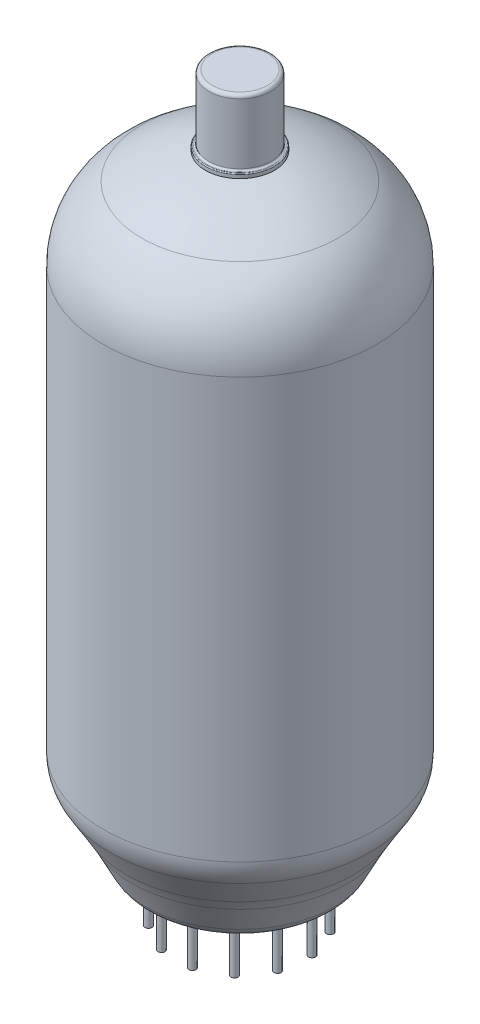
from build123d import *

# Parameters (mm, degrees)
CIRPATTERN1_COUNT           = 12
CIRPATTERN1_ANGLE           = 304.7
CUT_EXTRUDE1_DEPTH          = 2.54
CUT_EXTRUDE1_DEPTH_BACK     = 2.54
SKETCH7_R                   = 0.522536274
BOSS_EXTRUDE1_DEPTH         = 6.985
BOSS_EXTRUDE1_DEPTH_BACK    = 6.985
SKETCH7_2_R                 = 0.522536274
BOSS_EXTRUDE1_2_DEPTH       = 6.985
BOSS_EXTRUDE1_2_DEPTH_BACK  = 6.985
BOSS_EXTRUDE1_3_DEPTH       = 6.985
BOSS_EXTRUDE1_3_DEPTH_BACK  = 6.985
BOSS_EXTRUDE1_4_DEPTH       = 6.985
BOSS_EXTRUDE1_4_DEPTH_BACK  = 6.985
BOSS_EXTRUDE1_5_DEPTH       = 6.985
BOSS_EXTRUDE1_5_DEPTH_BACK  = 6.985
BOSS_EXTRUDE1_6_DEPTH       = 6.985
BOSS_EXTRUDE1_6_DEPTH_BACK  = 6.985
BOSS_EXTRUDE1_7_DEPTH       = 6.985
BOSS_EXTRUDE1_7_DEPTH_BACK  = 6.985
BOSS_EXTRUDE1_8_DEPTH       = 6.985
BOSS_EXTRUDE1_8_DEPTH_BACK  = 6.985
BOSS_EXTRUDE1_9_DEPTH       = 6.985
BOSS_EXTRUDE1_9_DEPTH_BACK  = 6.985
BOSS_EXTRUDE1_10_DEPTH      = 6.985
BOSS_EXTRUDE1_10_DEPTH_BACK = 6.985
BOSS_EXTRUDE1_11_DEPTH      = 6.985
BOSS_EXTRUDE1_11_DEPTH_BACK = 6.985
BOSS_EXTRUDE1_12_DEPTH      = 6.985
BOSS_EXTRUDE1_12_DEPTH_BACK = 6.985
FILLET2_R                   = 0.254
BOSS_EXTRUDE2_DEPTH         = 0.381
BOSS_EXTRUDE3_DEPTH         = 0.381
BOSS_EXTRUDE4_DEPTH         = 49.619
CUT_EXTRUDE2_DEPTH          = 32.512
CUT_EXTRUDE2_DEPTH_BACK     = 1.016
SKETCH11_W                  = 3.302
SKETCH11_H                  = 5.08
BOSS_EXTRUDE5_DEPTH         = 1.27
BOSS_EXTRUDE5_DEPTH_BACK    = 52.07
SKETCH14_R                  = 0.5953125
BOSS_EXTRUDE5_2_DEPTH       = 1.27
BOSS_EXTRUDE5_2_DEPTH_BACK  = 52.07
BOSS_EXTRUDE6_DEPTH         = 3.175
BOSS_EXTRUDE6_DEPTH_BACK    = 52.832
SKETCH15_R                  = 0.396875
BOSS_EXTRUDE6_2_DEPTH       = 3.175
BOSS_EXTRUDE6_2_DEPTH_BACK  = 52.832
SKETCH17_W                  = 0.2286
SKETCH17_H                  = 6.35
SKETCH18_W                  = 1.7145
SKETCH18_H                  = 3.175
BOSS_EXTRUDE7_DEPTH         = 0.508
BOSS_EXTRUDE7_2_DEPTH       = 0.508
SKETCH20_R                  = 0.3175
CUT_EXTRUDE3_DEPTH          = 3.175
CUT_EXTRUDE3_DEPTH_BACK     = 3.175
SKETCH21_W                  = 1.7145
SKETCH21_H                  = 3.175
SKETCH22_W                  = 4.8133
SKETCH22_H                  = 29.1338
SKETCH22_W_2                = 4.2545
SKETCH22_H_2                = 28.575
BOSS_EXTRUDE9_DEPTH         = 49
CUT_EXTRUDE5_DEPTH          = 0.254
CUT_EXTRUDE5_DEPTH_BACK     = 29.718
SKETCH23_W                  = 2.794
SKETCH23_H                  = 4.572
SKETCH24_R                  = 0.3175
BOSS_EXTRUDE10_DEPTH        = 12.446
BOSS_EXTRUDE10_2_DEPTH      = 12.446
BOSS_EXTRUDE11_DEPTH        = 1.905
BOSS_EXTRUDE11_DEPTH_BACK   = 41.148
SKETCH26_R                  = 0.127
SKETCH26_3_R                = 0.127


# Read off the part's stored shape, not the designer's step: Revolve-Thin2
with BuildPart() as part:
    # Sketch1 → Revolve-Thin1 (revolve)
    with BuildSketch(Plane.XY, mode=Mode.PRIVATE) as revolve_thin1_sk:
        with BuildLine():
            ThreePointArc((0, 91.2876), (7.482080905, 90.160598688), (14.3002, 86.879605144))
            ThreePointArc((14.3002, 86.879605144), (18.377216059, 82.320088485), (19.8501, 76.383602572))
            Line((19.8501, 76.383602572), (19.8501, 14.642450749))
            ThreePointArc((19.8501, 14.642450749), (19.619689794, 12.947422504), (18.945180078, 11.375402702))
            Line((18.945180078, 11.375402702), (16.505696372, 7.309596526))
            ThreePointArc((16.505696372, 7.309596526), (16.053521816, 6.526156501), (15.628175452, 5.727832899))
            Line((15.628175452, 5.727832899), (13.584296531, 1.72978117))
            ThreePointArc((13.584296531, 1.72978117), (12.414403956, 0.466753816), (10.757289715, 0))
            Line((10.757289715, 0), (3.060575478, 0))
            ThreePointArc((3.060575478, 0), (2.657992523, -0.14392774), (2.437906749, -0.510466254))
            Line((2.437906749, -0.510466254), (1.372093251, -5.839533746))
            ThreePointArc((1.372093251, -5.839533746), (1.152007477, -6.20607226), (0.749424522, -6.35))
            Line((0.749424522, -6.35), (0, -6.35))
            Line((0, -6.35), (0, -6.604))
            Line((0, -6.604), (0.749424522, -6.604))
            ThreePointArc((0.749424522, -6.604), (1.313040659, -6.402501164), (1.621160742, -5.889347244))
            Line((1.621160742, -5.889347244), (2.686974241, -0.560279753))
            ThreePointArc((2.686974241, -0.560279753), (2.819025705, -0.340356644), (3.060575478, -0.254))
            Line((3.060575478, -0.254), (10.757289715, -0.254))
            ThreePointArc((10.757289715, -0.254), (12.546973095, 0.250094121), (13.810457076, 1.614163664))
            Line((13.810457076, 1.614163664), (15.854335998, 5.612215393))
            ThreePointArc((15.854335998, 5.612215393), (16.275631444, 6.402935912), (16.723499575, 7.178914604))
            Line((16.723499575, 7.178914604), (19.162983281, 11.244720781))
            ThreePointArc((19.162983281, 11.244720781), (19.864473386, 12.879621375), (20.1041, 14.642450749))
            Line((20.1041, 14.642450749), (20.1041, 76.383602572))
            ThreePointArc((20.1041, 76.383602572), (18.60175838, 82.438818204), (14.443202, 87.089525195))
            ThreePointArc((14.443202, 87.089525195), (7.556901714, 90.403328675), (0, 91.5416))
            Line((0, 91.5416), (0, 91.2876))
        make_face()
    revolve(revolve_thin1_sk.sketch.rotate(Axis((0, 0, 0), (0, 1, 0)), 90), axis=Axis((0, 0, 0), (0, 1, 0)))

    # Sketch6 → Revolve1 (revolve)
    with BuildSketch(Plane(origin=(4.420259293, -0.254, -8.437234901), x_dir=(-0.8857989397800274, 0, -0.4640692171266903), z_dir=(0.4640692171266903, 0, -0.8857989397800274)), mode=Mode.PRIVATE) as revolve1_sk:
        Polygon((0, 0), (0, -0.635), (-0.508, -0.635), (-1.143, 0), align=None)
    revolve1 = revolve(revolve1_sk.sketch.rotate(Axis((4.420259293, -0.254, -8.437234901), (0, -1, 0)), 62.35), axis=Axis((4.420259293, -0.254, -8.437234901), (0, -1, 0)))

    # CirPattern1: Revolve1 ×12 about axis
    cirpattern1_axis = Axis((0, 0, 0), (0, -1, 0))
    for i in range(1, CIRPATTERN1_COUNT):
        add(revolve1.rotate(cirpattern1_axis, i * CIRPATTERN1_ANGLE / (CIRPATTERN1_COUNT - 1)))

    # Sketch7 → Cut-Extrude1 (cut, two sides: drawn at the far end of the back side and taken through both)
    with BuildSketch(Plane.XZ.offset(0.254).offset(-CUT_EXTRUDE1_DEPTH_BACK)):
        with Locations(Location((4.420259293, -8.437234901, 0), (0, 0, 90))):
            Circle(SKETCH7_R)
        with Locations(Location((7.835650934, -5.415551628, 0), (0, 0, 90))):
            Circle(SKETCH7_R)
        with Locations(Location((9.455011488, -1.152554882, 0), (0, 0, 90))):
            Circle(SKETCH7_R)
        with Locations(Location((8.907162872, 3.374622137, 0), (0, 0, 90))):
            Circle(SKETCH7_R)
        with Locations(Location((6.317678973, 7.128292741, 0), (0, 0, 270))):
            Circle(SKETCH7_R)
        with Locations(Location((2.280102512, 9.248067773, 0), (0, 0, 270))):
            Circle(SKETCH7_R)
        with Locations(Location((-2.280102512, 9.248067773, 0), (0, 0, 270))):
            Circle(SKETCH7_R)
        with Locations(Location((-6.317678973, 7.128292741, 0), (0, 0, 270))):
            Circle(SKETCH7_R)
        with Locations(Location((-8.907162872, 3.374622137, 0), (0, 0, 270))):
            Circle(SKETCH7_R)
        with Locations(Location((-9.455011488, -1.152554882, 0), (0, 0, 270))):
            Circle(SKETCH7_R)
        with Locations(Location((-7.835650934, -5.415551628, 0), (0, 0, 90))):
            Circle(SKETCH7_R)
        with Locations(Location((-4.420259293, -8.437234901, 0), (0, 0, 90))):
            Circle(SKETCH7_R)
    extrude(amount=CUT_EXTRUDE1_DEPTH + CUT_EXTRUDE1_DEPTH_BACK, mode=Mode.SUBTRACT)



with BuildPart() as body_2:
    # Revolve-Thin2 outline → Revolve-Thin2 (revolve)
    with BuildSketch(Plane.XY):
        with BuildLine():
            Line((4.826, 91.4146), (4.826, 91.0336))
            Line((4.826, 91.0336), (5.08, 91.0336))
            Line((5.08, 91.0336), (5.08, 91.5416))
            ThreePointArc((5.08, 91.5416), (5.042802561, 91.631402561), (4.953, 91.6686))
            Line((4.953, 91.6686), (4.826, 91.6686))
            ThreePointArc((4.826, 91.6686), (4.646394878, 91.742994878), (4.572, 91.9226))
            Line((4.572, 91.9226), (4.572, 100.838))
            ThreePointArc((4.572, 100.838), (4.423210245, 101.197210245), (4.064, 101.346))
            Line((4.064, 101.346), (0, 101.346))
            Line((0, 101.346), (0, 101.092))
            Line((0, 101.092), (4.064, 101.092))
            ThreePointArc((4.064, 101.092), (4.243605122, 101.017605122), (4.318, 100.838))
            Line((4.318, 100.838), (4.318, 91.9226))
            ThreePointArc((4.318, 91.9226), (4.466789755, 91.563389755), (4.826, 91.4146))
        make_face()
    revolve(axis=Axis((0, 0, 0), (0, 1, 0)))


with BuildPart() as body_3:
    # Sketch7<2> → Boss-Extrude1 (new, two sides: drawn at the far end of the back side and taken through both)
    with BuildSketch(Plane.XZ.offset(0.254).offset(-BOSS_EXTRUDE1_DEPTH_BACK)):
        with Locations(Location((4.420259293, -8.437234901, 0), (0, 0, 270))):
            Circle(SKETCH7_2_R)
    extrude(amount=BOSS_EXTRUDE1_DEPTH + BOSS_EXTRUDE1_DEPTH_BACK)

    # Fillet2
    fillet2_edges = [body_3.edges().sort_by_distance(p)[0] for p in [
        (4.420259293, -7.239, -7.914698628),
    ]]
    fillet(fillet2_edges, radius=FILLET2_R)


with BuildPart() as body_4:
    # Sketch7<2> → Boss-Extrude1 2 (new, two sides: drawn at the far end of the back side and taken through both)
    with BuildSketch(Plane.XZ.offset(0.254).offset(-BOSS_EXTRUDE1_2_DEPTH_BACK)):
        with Locations(Location((7.835650934, -5.415551628, 0), (0, 0, 270))):
            Circle(SKETCH7_2_R)
    extrude(amount=BOSS_EXTRUDE1_2_DEPTH + BOSS_EXTRUDE1_2_DEPTH_BACK)


with BuildPart() as body_5:
    # Sketch7<2> → Boss-Extrude1 3 (new, two sides: drawn at the far end of the back side and taken through both)
    with BuildSketch(Plane.XZ.offset(0.254).offset(-BOSS_EXTRUDE1_3_DEPTH_BACK)):
        with Locations(Location((9.455011488, -1.152554882, 0), (0, 0, 270))):
            Circle(SKETCH7_2_R)
    extrude(amount=BOSS_EXTRUDE1_3_DEPTH + BOSS_EXTRUDE1_3_DEPTH_BACK)


with BuildPart() as body_6:
    # Sketch7<2> → Boss-Extrude1 4 (new, two sides: drawn at the far end of the back side and taken through both)
    with BuildSketch(Plane.XZ.offset(0.254).offset(-BOSS_EXTRUDE1_4_DEPTH_BACK)):
        with Locations(Location((8.907162872, 3.374622137, 0), (0, 0, 270))):
            Circle(SKETCH7_2_R)
    extrude(amount=BOSS_EXTRUDE1_4_DEPTH + BOSS_EXTRUDE1_4_DEPTH_BACK)


with BuildPart() as body_7:
    # Sketch7<2> → Boss-Extrude1 5 (new, two sides: drawn at the far end of the back side and taken through both)
    with BuildSketch(Plane.XZ.offset(0.254).offset(-BOSS_EXTRUDE1_5_DEPTH_BACK)):
        with Locations(Location((6.317678973, 7.128292741, 0), (0, 0, 270))):
            Circle(SKETCH7_2_R)
    extrude(amount=BOSS_EXTRUDE1_5_DEPTH + BOSS_EXTRUDE1_5_DEPTH_BACK)


with BuildPart() as body_8:
    # Sketch7<2> → Boss-Extrude1 6 (new, two sides: drawn at the far end of the back side and taken through both)
    with BuildSketch(Plane.XZ.offset(0.254).offset(-BOSS_EXTRUDE1_6_DEPTH_BACK)):
        with Locations(Location((2.280102512, 9.248067773, 0), (0, 0, 270))):
            Circle(SKETCH7_2_R)
    extrude(amount=BOSS_EXTRUDE1_6_DEPTH + BOSS_EXTRUDE1_6_DEPTH_BACK)


with BuildPart() as body_9:
    # Sketch7<2> → Boss-Extrude1 7 (new, two sides: drawn at the far end of the back side and taken through both)
    with BuildSketch(Plane.XZ.offset(0.254).offset(-BOSS_EXTRUDE1_7_DEPTH_BACK)):
        with Locations(Location((-2.280102512, 9.248067773, 0), (0, 0, 270))):
            Circle(SKETCH7_2_R)
    extrude(amount=BOSS_EXTRUDE1_7_DEPTH + BOSS_EXTRUDE1_7_DEPTH_BACK)


with BuildPart() as body_10:
    # Sketch7<2> → Boss-Extrude1 8 (new, two sides: drawn at the far end of the back side and taken through both)
    with BuildSketch(Plane.XZ.offset(0.254).offset(-BOSS_EXTRUDE1_8_DEPTH_BACK)):
        with Locations(Location((-6.317678973, 7.128292741, 0), (0, 0, 270))):
            Circle(SKETCH7_2_R)
    extrude(amount=BOSS_EXTRUDE1_8_DEPTH + BOSS_EXTRUDE1_8_DEPTH_BACK)


with BuildPart() as body_11:
    # Sketch7<2> → Boss-Extrude1 9 (new, two sides: drawn at the far end of the back side and taken through both)
    with BuildSketch(Plane.XZ.offset(0.254).offset(-BOSS_EXTRUDE1_9_DEPTH_BACK)):
        with Locations(Location((-8.907162872, 3.374622137, 0), (0, 0, 270))):
            Circle(SKETCH7_2_R)
    extrude(amount=BOSS_EXTRUDE1_9_DEPTH + BOSS_EXTRUDE1_9_DEPTH_BACK)


with BuildPart() as body_12:
    # Sketch7<2> → Boss-Extrude1 10 (new, two sides: drawn at the far end of the back side and taken through both)
    with BuildSketch(Plane.XZ.offset(0.254).offset(-BOSS_EXTRUDE1_10_DEPTH_BACK)):
        with Locations(Location((-9.455011488, -1.152554882, 0), (0, 0, 270))):
            Circle(SKETCH7_2_R)
    extrude(amount=BOSS_EXTRUDE1_10_DEPTH + BOSS_EXTRUDE1_10_DEPTH_BACK)


with BuildPart() as body_13:
    # Sketch7<2> → Boss-Extrude1 11 (new, two sides: drawn at the far end of the back side and taken through both)
    with BuildSketch(Plane.XZ.offset(0.254).offset(-BOSS_EXTRUDE1_11_DEPTH_BACK)):
        with Locations(Location((-7.835650934, -5.415551628, 0), (0, 0, 270))):
            Circle(SKETCH7_2_R)
    extrude(amount=BOSS_EXTRUDE1_11_DEPTH + BOSS_EXTRUDE1_11_DEPTH_BACK)


with BuildPart() as body_14:
    # Sketch7<2> → Boss-Extrude1 12 (new, two sides: drawn at the far end of the back side and taken through both)
    with BuildSketch(Plane.XZ.offset(0.254).offset(-BOSS_EXTRUDE1_12_DEPTH_BACK)):
        with Locations(Location((-4.420259293, -8.437234901, 0), (0, 0, 270))):
            Circle(SKETCH7_2_R)
    extrude(amount=BOSS_EXTRUDE1_12_DEPTH + BOSS_EXTRUDE1_12_DEPTH_BACK)


with BuildPart() as body_15:
    # Sketch8 → Boss-Extrude2 (new body)
    with BuildSketch(Plane(origin=(0, 19.05, 0), x_dir=(1, 0, 0), z_dir=(0, 1, 0))):
        with BuildLine():
            Line((-9.438620861, 17.4625), (9.438620861, 17.4625))
            Line((9.438620861, 17.4625), (8.720765979, 16.219138872))
            ThreePointArc((8.720765979, 16.219138872), (9.982707907, 15.474423021), (11.181444024, 14.631730401))
            Line((11.181444024, 14.631730401), (12.759398331, 15.2060588))
            Line((12.759398331, 15.2060588), (12.467804161, 13.552346085))
            ThreePointArc((12.467804161, 13.552346085), (13.845130055, 12.141853185), (15.063778888, 10.592204238))
            Line((15.063778888, 10.592204238), (16.741404539, 10.665450956))
            Line((16.741404539, 10.665450956), (15.966025232, 9.175961165))
            ThreePointArc((15.966025232, 9.175961165), (16.855460888, 7.416580294), (17.551718512, 5.572199053))
            Line((17.551718512, 5.572199053), (19.173724244, 5.137583927))
            Line((19.173724244, 5.137583927), (17.986333638, 3.950193321))
            ThreePointArc((17.986333638, 3.950193321), (18.415, 0), (17.986333638, -3.950193321))
            Line((17.986333638, -3.950193321), (19.173724244, -5.137583927))
            Line((19.173724244, -5.137583927), (17.551718512, -5.572199053))
            ThreePointArc((17.551718512, -5.572199053), (16.855460888, -7.416580294), (15.966025232, -9.175961165))
            Line((15.966025232, -9.175961165), (16.741404539, -10.665450956))
            Line((16.741404539, -10.665450956), (15.063778888, -10.592204238))
            ThreePointArc((15.063778888, -10.592204238), (13.845130055, -12.141853185), (12.467804161, -13.552346085))
            Line((12.467804161, -13.552346085), (12.759398331, -15.2060588))
            Line((12.759398331, -15.2060588), (11.181444024, -14.631730401))
            ThreePointArc((11.181444024, -14.631730401), (9.982707907, -15.474423021), (8.720765979, -16.219138872))
            Line((8.720765979, -16.219138872), (9.438620861, -17.4625))
            Line((9.438620861, -17.4625), (-9.438620861, -17.4625))
            Line((-9.438620861, -17.4625), (-8.720765979, -16.219138872))
            ThreePointArc((-8.720765979, -16.219138872), (-9.982707907, -15.474423021), (-11.181444024, -14.631730401))
            Line((-11.181444024, -14.631730401), (-12.759398331, -15.2060588))
            Line((-12.759398331, -15.2060588), (-12.467804161, -13.552346085))
            ThreePointArc((-12.467804161, -13.552346085), (-13.845130055, -12.141853185), (-15.063778888, -10.592204238))
            Line((-15.063778888, -10.592204238), (-16.741404539, -10.665450956))
            Line((-16.741404539, -10.665450956), (-15.966025232, -9.175961165))
            ThreePointArc((-15.966025232, -9.175961165), (-16.855460888, -7.416580294), (-17.551718512, -5.572199053))
            Line((-17.551718512, -5.572199053), (-19.173724244, -5.137583927))
            Line((-19.173724244, -5.137583927), (-17.986333638, -3.950193321))
            ThreePointArc((-17.986333638, -3.950193321), (-18.415, 0), (-17.986333638, 3.950193321))
            Line((-17.986333638, 3.950193321), (-19.173724244, 5.137583927))
            Line((-19.173724244, 5.137583927), (-17.551718512, 5.572199053))
            ThreePointArc((-17.551718512, 5.572199053), (-16.855460888, 7.416580294), (-15.966025232, 9.175961165))
            Line((-15.966025232, 9.175961165), (-16.741404539, 10.665450956))
            Line((-16.741404539, 10.665450956), (-15.063778888, 10.592204238))
            ThreePointArc((-15.063778888, 10.592204238), (-13.845130055, 12.141853185), (-12.467804161, 13.552346085))
            Line((-12.467804161, 13.552346085), (-12.759398331, 15.2060588))
            Line((-12.759398331, 15.2060588), (-11.181444024, 14.631730401))
            ThreePointArc((-11.181444024, 14.631730401), (-9.982707907, 15.474423021), (-8.720765979, 16.219138872))
            Line((-8.720765979, 16.219138872), (-9.438620861, 17.4625))
        make_face()
    extrude(amount=BOSS_EXTRUDE2_DEPTH)


with BuildPart() as body_16:
    # Sketch9 → Boss-Extrude3 (new body)
    with BuildSketch(Plane(origin=(0, 69.05, 0), x_dir=(1, 0, 0), z_dir=(0, 1, 0))):
        with BuildLine():
            Line((-9.438620861, 17.4625), (9.438620861, 17.4625))
            Line((9.438620861, 17.4625), (8.720765979, 16.219138872))
            ThreePointArc((8.720765979, 16.219138872), (9.982707907, 15.474423021), (11.181444024, 14.631730401))
            Line((11.181444024, 14.631730401), (12.759398331, 15.2060588))
            Line((12.759398331, 15.2060588), (12.467804161, 13.552346085))
            ThreePointArc((12.467804161, 13.552346085), (13.845130055, 12.141853185), (15.063778888, 10.592204238))
            Line((15.063778888, 10.592204238), (16.741404539, 10.665450956))
            Line((16.741404539, 10.665450956), (15.966025232, 9.175961165))
            ThreePointArc((15.966025232, 9.175961165), (16.855460888, 7.416580294), (17.551718512, 5.572199053))
            Line((17.551718512, 5.572199053), (19.173724244, 5.137583927))
            Line((19.173724244, 5.137583927), (17.986333638, 3.950193321))
            ThreePointArc((17.986333638, 3.950193321), (18.415, 0), (17.986333638, -3.950193321))
            Line((17.986333638, -3.950193321), (19.173724244, -5.137583927))
            Line((19.173724244, -5.137583927), (17.551718512, -5.572199053))
            ThreePointArc((17.551718512, -5.572199053), (16.855460888, -7.416580294), (15.966025232, -9.175961165))
            Line((15.966025232, -9.175961165), (16.741404539, -10.665450956))
            Line((16.741404539, -10.665450956), (15.063778888, -10.592204238))
            ThreePointArc((15.063778888, -10.592204238), (13.845130055, -12.141853185), (12.467804161, -13.552346085))
            Line((12.467804161, -13.552346085), (12.759398331, -15.2060588))
            Line((12.759398331, -15.2060588), (11.181444024, -14.631730401))
            ThreePointArc((11.181444024, -14.631730401), (9.982707907, -15.474423021), (8.720765979, -16.219138872))
            Line((8.720765979, -16.219138872), (9.438620861, -17.4625))
            Line((9.438620861, -17.4625), (-9.438620861, -17.4625))
            Line((-9.438620861, -17.4625), (-8.720765979, -16.219138872))
            ThreePointArc((-8.720765979, -16.219138872), (-9.982707907, -15.474423021), (-11.181444024, -14.631730401))
            Line((-11.181444024, -14.631730401), (-12.759398331, -15.2060588))
            Line((-12.759398331, -15.2060588), (-12.467804161, -13.552346085))
            ThreePointArc((-12.467804161, -13.552346085), (-13.845130055, -12.141853185), (-15.063778888, -10.592204238))
            Line((-15.063778888, -10.592204238), (-16.741404539, -10.665450956))
            Line((-16.741404539, -10.665450956), (-15.966025232, -9.175961165))
            ThreePointArc((-15.966025232, -9.175961165), (-16.855460888, -7.416580294), (-17.551718512, -5.572199053))
            Line((-17.551718512, -5.572199053), (-19.173724244, -5.137583927))
            Line((-19.173724244, -5.137583927), (-17.986333638, -3.950193321))
            ThreePointArc((-17.986333638, -3.950193321), (-18.415, 0), (-17.986333638, 3.950193321))
            Line((-17.986333638, 3.950193321), (-19.173724244, 5.137583927))
            Line((-19.173724244, 5.137583927), (-17.551718512, 5.572199053))
            ThreePointArc((-17.551718512, 5.572199053), (-16.855460888, 7.416580294), (-15.966025232, 9.175961165))
            Line((-15.966025232, 9.175961165), (-16.741404539, 10.665450956))
            Line((-16.741404539, 10.665450956), (-15.063778888, 10.592204238))
            ThreePointArc((-15.063778888, 10.592204238), (-13.845130055, 12.141853185), (-12.467804161, 13.552346085))
            Line((-12.467804161, 13.552346085), (-12.759398331, 15.2060588))
            Line((-12.759398331, 15.2060588), (-11.181444024, 14.631730401))
            ThreePointArc((-11.181444024, 14.631730401), (-9.982707907, 15.474423021), (-8.720765979, 16.219138872))
            Line((-8.720765979, 16.219138872), (-9.438620861, 17.4625))
        make_face()
    extrude(amount=BOSS_EXTRUDE3_DEPTH)


with BuildPart() as body_17:
    # Sketch10 → Boss-Extrude4 (new body)
    with BuildSketch(Plane(origin=(0, 19.431, 0), x_dir=(1, 0, 0), z_dir=(0, 1, 0))):
        Polygon((-3.175, 4.7625), (-3.175, 14.605), (-1.905, 15.875), (1.905, 15.875), (3.175, 14.605), (3.175, 4.7625), (6.35, 4.7625), (6.985, 4.1275), (6.985, 0.254), (14.9225, 0.254), (14.9225, -0.254), (6.985, -0.254), (6.985, -4.1275), (6.35, -4.7625), (3.175, -4.7625), (3.175, -14.605), (1.905, -15.875), (-1.905, -15.875), (-3.175, -14.605), (-3.175, -4.7625), (-6.35, -4.7625), (-6.985, -4.1275), (-6.985, -0.254), (-14.9225, -0.254), (-14.9225, 0.254), (-6.985, 0.254), (-6.985, 4.1275), (-6.35, 4.7625), align=None)
        Polygon((-2.9464, 4.5339), (-2.9464, 14.51031078), (-1.81031078, 15.6464), (1.81031078, 15.6464), (2.9464, 14.51031078), (2.9464, 4.5339), (6.25531078, 4.5339), (6.7564, 4.03281078), (6.7564, -4.03281078), (6.25531078, -4.5339), (2.9464, -4.5339), (2.9464, -14.51031078), (1.81031078, -15.6464), (-1.81031078, -15.6464), (-2.9464, -14.51031078), (-2.9464, -4.5339), (-6.25531078, -4.5339), (-6.7564, -4.03281078), (-6.7564, 4.03281078), (-6.25531078, 4.5339), align=None, mode=Mode.SUBTRACT)
    extrude(amount=BOSS_EXTRUDE4_DEPTH)

    # Sketch11 → Cut-Extrude2 (cut, two sides: drawn at the far end of the back side and taken through both)
    with BuildSketch(Plane.XY.offset(-15.6464).offset(-CUT_EXTRUDE2_DEPTH_BACK)):
        with Locations((0, 29.0005)):
            Rectangle(SKETCH11_W, SKETCH11_H)
        with Locations((0, 49.3205)):
            Rectangle(SKETCH11_W, SKETCH11_H)
        with Locations((0, 59.4805)):
            Rectangle(SKETCH11_W, SKETCH11_H)
        with Locations((0, 39.1605)):
            Rectangle(SKETCH11_W, SKETCH11_H)
    extrude(amount=CUT_EXTRUDE2_DEPTH + CUT_EXTRUDE2_DEPTH_BACK, mode=Mode.SUBTRACT)

    # Sketch21 → Cut-Extrude3 (cut, two sides: drawn at the far end of the back side and taken through both)
    with BuildSketch(Plane.XY.offset(0.254).offset(-CUT_EXTRUDE3_DEPTH_BACK)):
        with Locations((-12.35075, 62.3825)):
            Rectangle(SKETCH21_W, SKETCH21_H)
        with Locations((-12.35075, 28.6385)):
            Rectangle(SKETCH21_W, SKETCH21_H)
        with Locations((12.35075, 28.6385)):
            Rectangle(SKETCH21_W, SKETCH21_H)
        with Locations((12.35075, 62.3825)):
            Rectangle(SKETCH21_W, SKETCH21_H)
    extrude(amount=CUT_EXTRUDE3_DEPTH + CUT_EXTRUDE3_DEPTH_BACK, mode=Mode.SUBTRACT)


with BuildPart() as body_18:
    # Sweep1: sweep along a path in Sketch12
    with BuildLine(Plane(origin=(0, 69.431, 0), x_dir=(1, 0, 0), z_dir=(0, 1, 0))) as sweep1_path:
        Line((-1.905, -9.525), (1.905, -9.525))
        ThreePointArc((1.905, -9.525), (2.803025612, -9.153025612), (3.175, -8.255))
        Line((3.175, -8.255), (3.175, 8.255))
        ThreePointArc((3.175, 8.255), (2.803025612, 9.153025612), (1.905, 9.525))
        Line((1.905, 9.525), (-1.905, 9.525))
        ThreePointArc((-1.905, 9.525), (-2.803025612, 9.153025612), (-3.175, 8.255))
        Line((-3.175, 8.255), (-3.175, -8.255))
        ThreePointArc((-3.175, -8.255), (-2.803025612, -9.153025612), (-1.905, -9.525))
    # Sketch13 → Sweep1 (sweep)
    with BuildSketch(Plane(origin=(-3.175, 69.431, 8.255), x_dir=(-1, 0, 0), z_dir=(0, 0, -1))):
        with BuildLine():
            Line((0, 0), (-0.450022883, 0.27001373))
            ThreePointArc((-0.450022883, 0.27001373), (-0.585546164, 0.409000286), (-0.635, 0.596718534))
            Line((-0.635, 0.596718534), (-0.635, 0.762))
            Line((-0.635, 0.762), (-0.5715, 0.762))
            Line((-0.5715, 0.762), (-0.5715, 0.596718534))
            ThreePointArc((-0.5715, 0.596718534), (-0.53028847, 0.440286661), (-0.417352402, 0.32446453))
            Line((-0.417352402, 0.32446453), (0.03267048, 0.054450801))
            Line((0.03267048, 0.054450801), (0.635, 0.054450801))
            Line((0.635, 0.054450801), (0.635, 0))
            Line((0.635, 0), (0, 0))
        make_face()
    sweep(path=sweep1_path.line)


with BuildPart() as body_19:
    # Sketch14 → Boss-Extrude5 (new, two sides: drawn at the far end of the back side and taken through both)
    with BuildSketch(Plane(origin=(0, 69.431, 0), x_dir=(1, 0, 0), z_dir=(0, 1, 0)).offset(-BOSS_EXTRUDE5_DEPTH_BACK)):
        with Locations(Location((0, 6.35, 0), (0, 0, 270))):
            Circle(SKETCH14_R)
    extrude(amount=BOSS_EXTRUDE5_DEPTH + BOSS_EXTRUDE5_DEPTH_BACK)


with BuildPart() as body_20:
    # Sketch14 → Boss-Extrude5 2 (new, two sides: drawn at the far end of the back side and taken through both)
    with BuildSketch(Plane(origin=(0, 69.431, 0), x_dir=(1, 0, 0), z_dir=(0, 1, 0)).offset(-BOSS_EXTRUDE5_2_DEPTH_BACK)):
        with Locations(Location((0, -6.35, 0), (0, 0, 270))):
            Circle(SKETCH14_R)
    extrude(amount=BOSS_EXTRUDE5_2_DEPTH + BOSS_EXTRUDE5_2_DEPTH_BACK)


with BuildPart() as body_21:
    # Sketch15 → Boss-Extrude6 (new, two sides: drawn at the far end of the back side and taken through both)
    with BuildSketch(Plane(origin=(0, 69.431, 0), x_dir=(1, 0, 0), z_dir=(0, 1, 0)).offset(-BOSS_EXTRUDE6_DEPTH_BACK)):
        with Locations(Location((0, 2.8575, 0), (0, 0, 270))):
            Circle(SKETCH15_R)
    extrude(amount=BOSS_EXTRUDE6_DEPTH + BOSS_EXTRUDE6_DEPTH_BACK)


with BuildPart() as body_22:
    # Sketch15 → Boss-Extrude6 2 (new, two sides: drawn at the far end of the back side and taken through both)
    with BuildSketch(Plane(origin=(0, 69.431, 0), x_dir=(1, 0, 0), z_dir=(0, 1, 0)).offset(-BOSS_EXTRUDE6_2_DEPTH_BACK)):
        with Locations(Location((0, -2.8575, 0), (0, 0, 270))):
            Circle(SKETCH15_R)
    extrude(amount=BOSS_EXTRUDE6_2_DEPTH + BOSS_EXTRUDE6_2_DEPTH_BACK)


with BuildPart() as body_23:
    # Sweep2: sweep along a path in Sketch16
    with BuildLine(Plane(origin=(0, 71.336, 0), x_dir=(1, 0, 0), z_dir=(0, 1, 0))) as sweep2_path:
        Line((0.635, 3.254375), (-5.3975, 3.254375))
        ThreePointArc((-5.3975, 3.254375), (-6.744538418, 2.696413418), (-7.3025, 1.349375))
        Line((-7.3025, 1.349375), (-7.3025, -1.349375))
        ThreePointArc((-7.3025, -1.349375), (-6.744538418, -2.696413418), (-5.3975, -3.254375))
        Line((-5.3975, -3.254375), (0.635, -3.254375))
    # Sketch17 → Sweep2 (sweep)
    with BuildSketch(Plane(origin=(0.635, 71.336, 3.254375), x_dir=(0, 0, -1), z_dir=(1, 0, 0))):
        with Locations((-0.138318963, 3.175)):
            Rectangle(SKETCH17_W, SKETCH17_H)
    sweep(path=sweep2_path.line)


with BuildPart() as body_24:
    # Sketch18 → Boss-Extrude7 (new body)
    with BuildSketch(Plane.XY.offset(0.254)):
        with Locations((14.06525, 70.6375)):
            Rectangle(SKETCH18_W, SKETCH18_H)
    extrude(amount=-BOSS_EXTRUDE7_DEPTH)


with BuildPart() as body_25:
    # Sketch18 → Boss-Extrude7 2 (new body)
    with BuildSketch(Plane.XY.offset(0.254)):
        with Locations((-14.06525, 70.6375)):
            Rectangle(SKETCH18_W, SKETCH18_H)
    extrude(amount=-BOSS_EXTRUDE7_2_DEPTH)


with BuildPart() as part_1:
    add(part.part)

    add(body_24.part)  # Sweep3 merges body 24
    # Sweep3: sweep along a path in Sketch19
    with BuildLine(Plane.XY) as sweep3_path:
        Line((0, 101.346), (0, 86.174006823))
        ThreePointArc((0, 86.174006823), (0.311887947, 85.12948828), (1.145426758, 84.426988366))
        Line((1.145426758, 84.426988366), (13.459573242, 79.073011634))
        ThreePointArc((13.459573242, 79.073011634), (14.293112053, 78.37051172), (14.605, 77.325993177))
        Line((14.605, 77.325993177), (14.605, 72.225))
    # Sketch20 → Sweep3 (sweep)
    with BuildSketch(Plane(origin=(0, 101.346, 0), x_dir=(1, 0, 0), z_dir=(0, 1, 0))):
        Circle(SKETCH20_R)
    sweep(path=sweep3_path.line)


with BuildPart() as body_25_2:
    # Sketch22 → Boss-Extrude9 (new body)
    with BuildSketch(Plane(origin=(0, 19.431, 0), x_dir=(1, 0, 0), z_dir=(0, 1, 0))):
        Rectangle(SKETCH22_W, SKETCH22_H)
        Rectangle(SKETCH22_W_2, SKETCH22_H_2, mode=Mode.SUBTRACT)
    extrude(amount=BOSS_EXTRUDE9_DEPTH)

    # Sketch23 → Cut-Extrude5 (cut, two sides: drawn at the far end of the back side and taken through both)
    with BuildSketch(Plane.XY.offset(14.5669).offset(-CUT_EXTRUDE5_DEPTH_BACK)):
        with Locations((0, 49.3205)):
            Rectangle(SKETCH23_W, SKETCH23_H)
        with Locations((0, 59.4805)):
            Rectangle(SKETCH23_W, SKETCH23_H)
        with Locations((0, 39.1605)):
            Rectangle(SKETCH23_W, SKETCH23_H)
        with Locations((0, 29.0005)):
            Rectangle(SKETCH23_W, SKETCH23_H)
    extrude(amount=CUT_EXTRUDE5_DEPTH + CUT_EXTRUDE5_DEPTH_BACK, mode=Mode.SUBTRACT)


with BuildPart() as body_26:
    # Sketch24 → Boss-Extrude10 (new body)
    with BuildSketch(Plane(origin=(0, 6.731, 0), x_dir=(1, 0, 0), z_dir=(0, 1, 0))):
        with Locations(Location((-2.280102512, -9.248067773, 0), (0, 0, 270))):
            Circle(SKETCH24_R)
    extrude(amount=BOSS_EXTRUDE10_DEPTH)


with BuildPart() as body_27:
    # Sketch24 → Boss-Extrude10 2 (new body)
    with BuildSketch(Plane(origin=(0, 6.731, 0), x_dir=(1, 0, 0), z_dir=(0, 1, 0))):
        with Locations(Location((2.280102512, -9.248067773, 0), (0, 0, 270))):
            Circle(SKETCH24_R)
    extrude(amount=BOSS_EXTRUDE10_2_DEPTH)


with BuildPart() as body_28:
    # Sketch25 → Boss-Extrude11 (new, two sides: drawn at the far end of the back side and taken through both)
    with BuildSketch(Plane(origin=(0, 69.431, 0), x_dir=(1, 0, 0), z_dir=(0, 1, 0)).offset(-BOSS_EXTRUDE11_DEPTH_BACK)):
        with BuildLine():
            Line((-0.254, -1.905), (0.254, -1.905))
            ThreePointArc((0.254, -1.905), (0.523407684, -1.793407684), (0.635, -1.524))
            Line((0.635, -1.524), (0.635, 1.524))
            ThreePointArc((0.635, 1.524), (0.523407684, 1.793407684), (0.254, 1.905))
            Line((0.254, 1.905), (-0.254, 1.905))
            ThreePointArc((-0.254, 1.905), (-0.523407684, 1.793407684), (-0.635, 1.524))
            Line((-0.635, 1.524), (-0.635, -1.524))
            ThreePointArc((-0.635, -1.524), (-0.523407684, -1.793407684), (-0.254, -1.905))
        make_face()
        with BuildLine():
            Line((-0.5715, -1.524), (-0.5715, 1.524))
            ThreePointArc((-0.5715, 1.524), (-0.478506403, 1.748506403), (-0.254, 1.8415))
            Line((-0.254, 1.8415), (0.254, 1.8415))
            ThreePointArc((0.254, 1.8415), (0.478506403, 1.748506403), (0.5715, 1.524))
            Line((0.5715, 1.524), (0.5715, -1.524))
            ThreePointArc((0.5715, -1.524), (0.478506403, -1.748506403), (0.254, -1.8415))
            Line((0.254, -1.8415), (-0.254, -1.8415))
            ThreePointArc((-0.254, -1.8415), (-0.478506403, -1.748506403), (-0.5715, -1.524))
        make_face(mode=Mode.SUBTRACT)
    extrude(amount=BOSS_EXTRUDE11_DEPTH + BOSS_EXTRUDE11_DEPTH_BACK)


with BuildPart() as body_29:
    # Sweep5: sweep along a curve in space
    with BuildLine() as sweep5_path:
        Line((0, 19.05, -1.234151776), (0, 15.321065218, -1.234151776))
        ThreePointArc((0, 15.321065218, -1.234151776), (-0.196756609, 13.670304397, -1.554778716), (-0.748172477, 12.345522934, -2.45334463))
        Line((-0.748172477, 12.345522934, -2.45334463), (-4.420259293, 6.731, -8.437234901))
    # Sketch26 → Sweep5 (sweep)
    with BuildSketch(Plane.XZ.offset(-19.05)):
        with Locations((0, -1.234151776)):
            Circle(SKETCH26_R)
    sweep(path=sweep5_path.line)


with BuildPart() as body_30:
    # Sweep6: sweep along a curve in space
    with BuildLine() as sweep6_path:
        Line((0, 19.05, 1.125221773), (0, 14.802674384, 1.125221773))
        ThreePointArc((0, 14.802674384, 1.125221773), (0.221642537, 12.867186979, 0.64573697), (0.825111297, 11.468387305, -0.659761982))
        Line((4.420259293, 6.731, -8.437234901), (0.825111297, 11.468387305, -0.659761982))
    # Sketch26<3> → Sweep6 (sweep)
    with BuildSketch(Plane.XZ.offset(-19.05)):
        with Locations((0, 1.125221773)):
            Circle(SKETCH26_3_R)
    sweep(path=sweep6_path.line)


solid = Compound([body_2.part, body_3.part, body_4.part, body_5.part, body_6.part, body_7.part, body_8.part, body_9.part, body_10.part, body_11.part, body_12.part, body_13.part, body_14.part, body_15.part, body_16.part, body_17.part, body_18.part, body_19.part, body_20.part, body_21.part, body_22.part, body_23.part, body_25.part, part_1.part, body_25_2.part, body_26.part, body_27.part, body_28.part, body_29.part, body_30.part])
